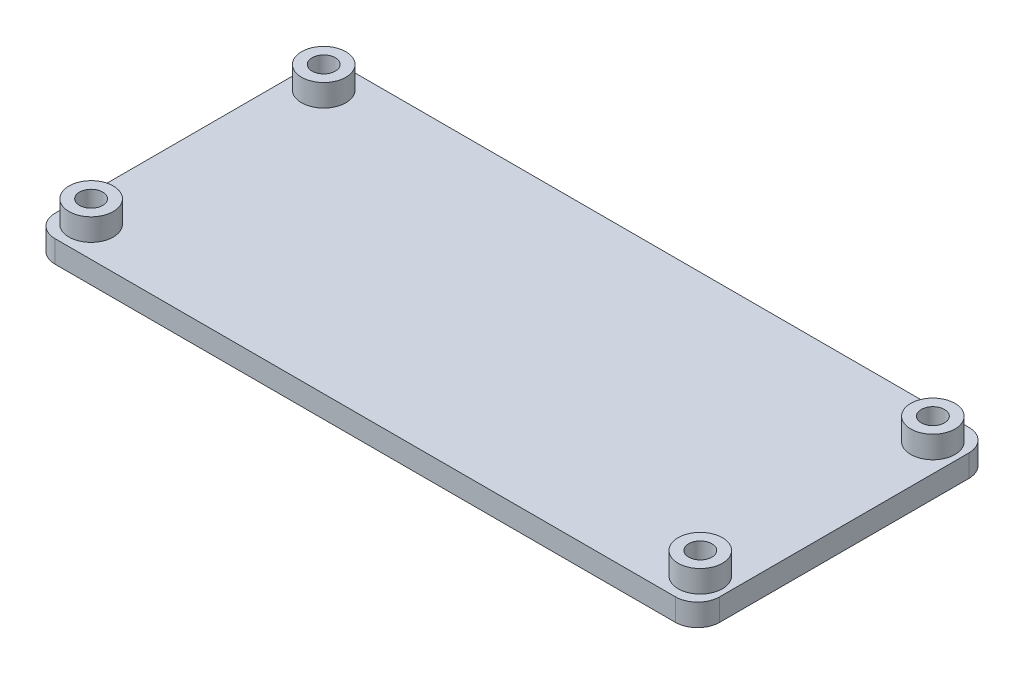
from build123d import *

# Parameters (mm, degrees)
SKETCH1_W           = 60
SKETCH1_H           = 26.5
BOSS_EXTRUDE1_DEPTH = 2
FILLET1_R           = 2
SKETCH2_R           = 2
BOSS_EXTRUDE2_DEPTH = 2
SKETCH4_R           = 1.05
CUT_EXTRUDE2_DEPTH  = 12


with BuildPart() as part:
    # Sketch1 → Boss-Extrude1 (new body)
    with BuildSketch(Plane(origin=(0, 0, 0), x_dir=(1, 0, 0), z_dir=(0, 1, 0))):
        Rectangle(SKETCH1_W, SKETCH1_H)
    extrude(amount=BOSS_EXTRUDE1_DEPTH)

    # Fillet1
    fillet1_edges = [part.edges().sort_by_distance(p)[0] for p in [
        (-30, 1, -13.25),
        (30, 1, -13.25),
        (30, 1, 13.25),
        (-30, 1, 13.25),
    ]]
    fillet(fillet1_edges, radius=FILLET1_R)

    # Sketch2 → Boss-Extrude2 (add)
    with BuildSketch(Plane(origin=(0, 2, 0), x_dir=(1, 0, 0), z_dir=(0, 1, 0))):
        with Locations((-27.5, 10.5)):
            Circle(SKETCH2_R)
        with Locations((27.5, 10.5)):
            Circle(SKETCH2_R)
        with Locations((27.5, -10.5)):
            Circle(SKETCH2_R)
        with Locations((-27.5, -10.5)):
            Circle(SKETCH2_R)
    extrude(amount=BOSS_EXTRUDE2_DEPTH)

    # Sketch4 → Cut-Extrude2 (cut)
    with BuildSketch(Plane(origin=(0, 4, 0), x_dir=(1, 0, 0), z_dir=(0, 1, 0))):
        with Locations((-27.5, 10.5)):
            Circle(SKETCH4_R)
        with Locations((-27.5, -10.5)):
            Circle(SKETCH4_R)
        with Locations((27.5, -10.5)):
            Circle(SKETCH4_R)
        with Locations((27.5, 10.5)):
            Circle(SKETCH4_R)
    extrude(amount=-CUT_EXTRUDE2_DEPTH, mode=Mode.SUBTRACT)


solid = part.part
